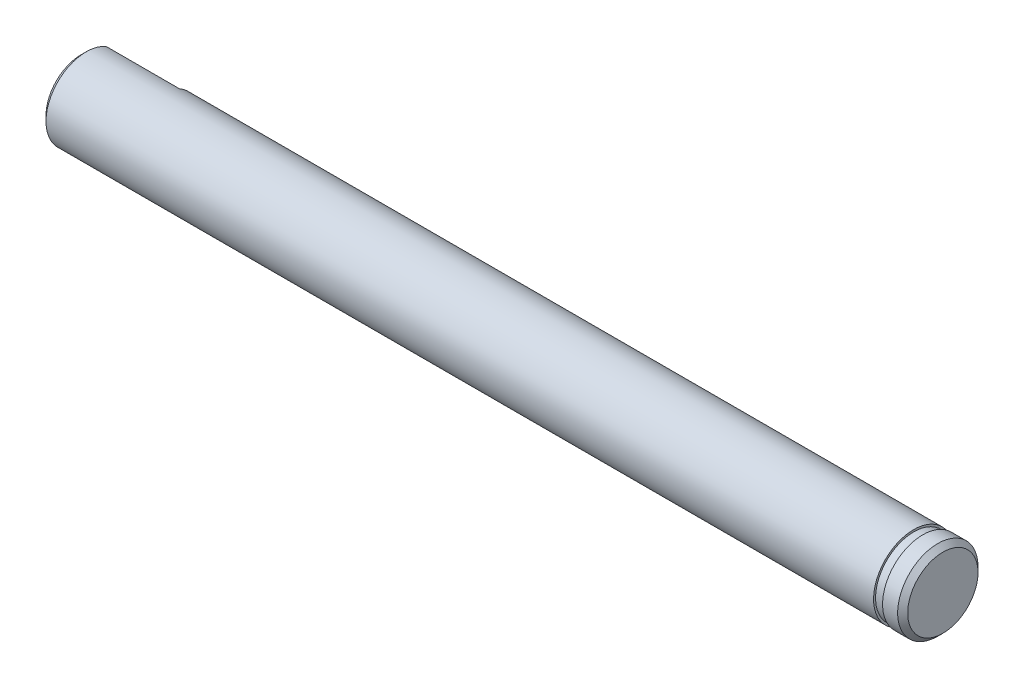
from build123d import *

# Parameters (mm, degrees)
BOSS_EXTRUDE1_DEPTH = 7.8
SKETCH2_R           = 4
BOSS_EXTRUDE2_DEPTH = 78
CUT_EXTRUDE1_START  = -2
SKETCH3_R           = 5
SKETCH3_R_2         = 3.8
CUT_EXTRUDE1_DEPTH  = 0.9
CHAMFER2_SIZE       = 0.5


with BuildPart() as part:
    # Sketch1 → Boss-Extrude1 (new body)
    with BuildSketch(Plane(origin=(0, 0, 0), x_dir=(0, 0, -1), z_dir=(1, 0, 0))):
        with BuildLine():
            Line((1.98, 3.475571895), (1.98, -3.475571895))
            ThreePointArc((1.98, -3.475571895), (-4, 0), (1.98, 3.475571895))
        make_face()
    extrude(amount=BOSS_EXTRUDE1_DEPTH)

    # Sketch2 → Boss-Extrude2 (add)
    with BuildSketch(Plane(origin=(7.8, 0, 0), x_dir=(0, 0, -1), z_dir=(1, 0, 0))):
        Circle(SKETCH2_R)
    extrude(amount=BOSS_EXTRUDE2_DEPTH)

    # Sketch3 → Cut-Extrude1 (cut)
    with BuildSketch(Plane(origin=(85.8, 0, 0), x_dir=(0, 0, -1), z_dir=(1, 0, 0)).offset(CUT_EXTRUDE1_START)):
        Circle(SKETCH3_R)
        Circle(SKETCH3_R_2, mode=Mode.SUBTRACT)
    extrude(amount=-CUT_EXTRUDE1_DEPTH, mode=Mode.SUBTRACT)

    # Cut-Extrude2 cone 1 section (through the dimple's axis) → Cut-Extrude2 (revolve, cut)
    with BuildSketch(Plane(origin=(43.025, 0, -4), x_dir=(0, 1, 0), z_dir=(1, 0, 0))):
        Polygon((0, 0), (1.778, 0), (0, 1.778), align=None)
    revolve(axis=Axis((43.025, 0, -4), (0, 0, 1)), mode=Mode.SUBTRACT)

    # Chamfer2
    chamfer2_edges = [part.edges().sort_by_distance(p)[0] for p in [
        (85.8, 0, 4),
        (0, 0, 4),
    ]]
    chamfer(chamfer2_edges, length=CHAMFER2_SIZE)


solid = part.part
